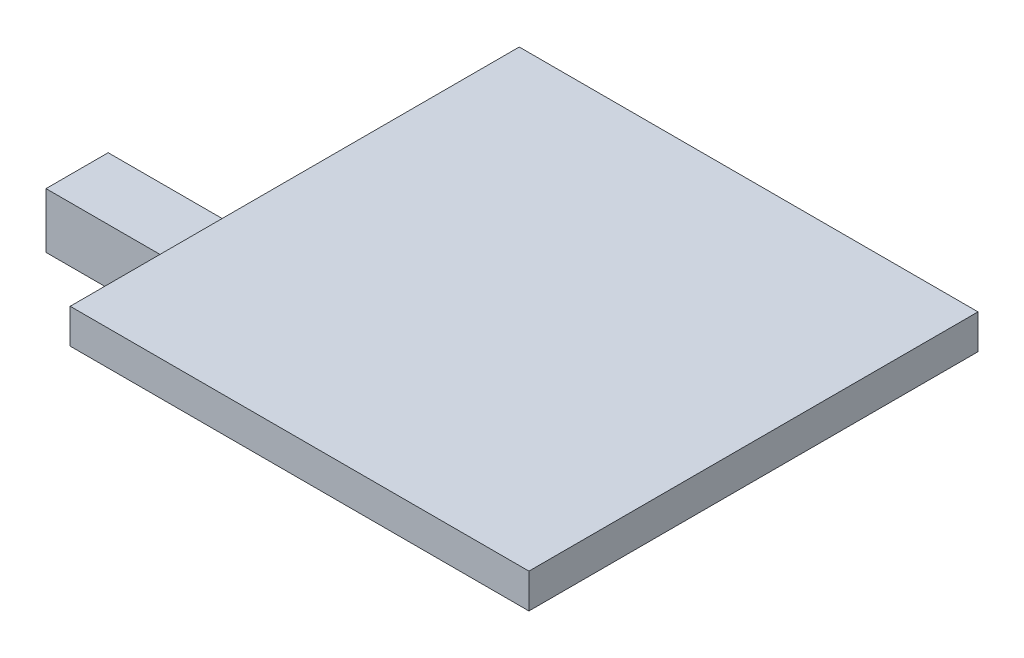
from build123d import *

# Parameters (mm, degrees)
SKETCH1_W           = 132.8
SKETCH1_H           = 10
BOSS_EXTRUDE1_DEPTH = 130
SKETCH3_W           = 10
SKETCH3_H           = 18
BOSS_EXTRUDE2_DEPTH = 16
SKETCH4_W           = 18
SKETCH4_H           = 16
BOSS_EXTRUDE3_DEPTH = 43
SKETCH5_W           = 8
SKETCH5_H           = 16
BOSS_EXTRUDE4_DEPTH = 10
SKETCH6_W           = 8
SKETCH6_H           = 16
BOSS_EXTRUDE5_DEPTH = 10
SKETCH7_W           = 2
SKETCH7_H           = 16
CUT_EXTRUDE1_DEPTH  = 20


with BuildPart() as part:
    # Sketch1 → Boss-Extrude1 (new body)
    with BuildSketch(Plane.XY):
        with Locations((0.806477733, -13.011336032)):
            Rectangle(SKETCH1_W, SKETCH1_H)
    extrude(amount=BOSS_EXTRUDE1_DEPTH)

    # Sketch3 → Boss-Extrude2 (add)
    with BuildSketch(Plane.XZ.offset(18.011336032)):
        with Locations((-60.593522267, 85)):
            Rectangle(SKETCH3_W, SKETCH3_H)
    extrude(amount=BOSS_EXTRUDE2_DEPTH)

    # Sketch4 → Boss-Extrude3 (add)
    with BuildSketch(Plane.ZY.offset(65.593522267)):
        with Locations((85, -26.011336032)):
            Rectangle(SKETCH4_W, SKETCH4_H)
    extrude(amount=BOSS_EXTRUDE3_DEPTH)

    # Sketch5 → Boss-Extrude4 (add)
    with BuildSketch(Plane.XY.offset(94)):
        with Locations((-61.593522267, -26.011336032)):
            Rectangle(SKETCH5_W, SKETCH5_H)
    extrude(amount=BOSS_EXTRUDE4_DEPTH)

    # Sketch6 → Boss-Extrude5 (add)
    with BuildSketch(Plane(origin=(0, 0, 76), x_dir=(-1, 0, 0), z_dir=(0, 0, -1))):
        with Locations((61.593522267, -26.011336032)):
            Rectangle(SKETCH6_W, SKETCH6_H)
    extrude(amount=BOSS_EXTRUDE5_DEPTH)

    # Sketch7 → Cut-Extrude1 (cut)
    with BuildSketch(Plane(origin=(0, 0, 76), x_dir=(-1, 0, 0), z_dir=(0, 0, -1))):
        with Locations((56.593522267, -26.011336032)):
            Rectangle(SKETCH7_W, SKETCH7_H)
    extrude(amount=-CUT_EXTRUDE1_DEPTH, mode=Mode.SUBTRACT)


solid = part.part
